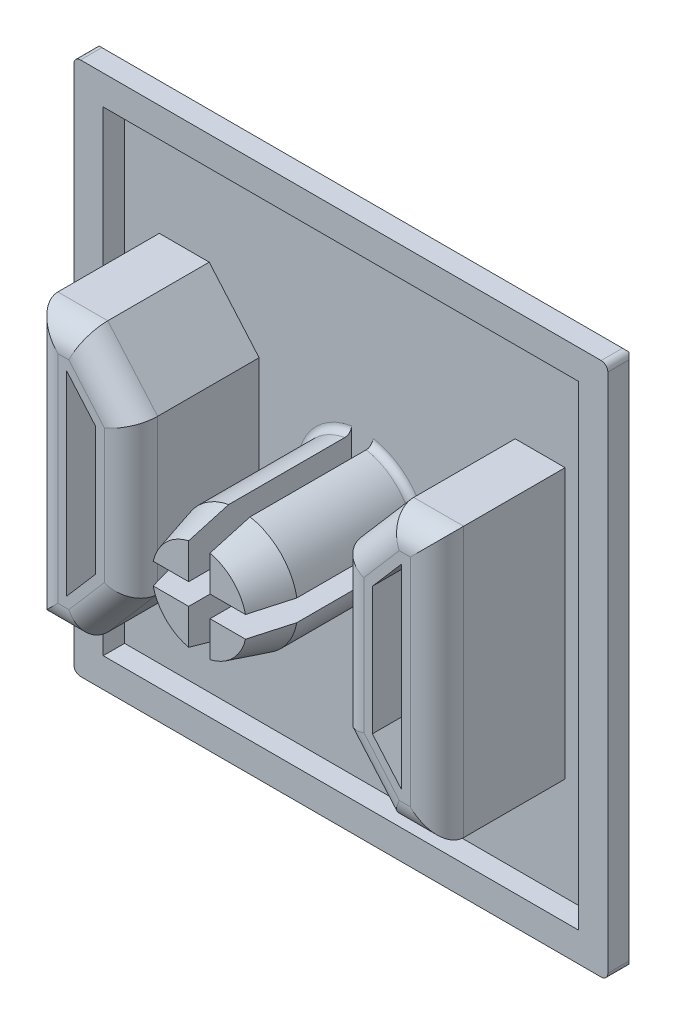
from build123d import *
from OCP.BRepFilletAPI import BRepFilletAPI_MakeChamfer

# Parameters (mm, degrees)
SKETCH3_W           = 20
SKETCH3_H           = 20
BOSS_EXTRUDE1_DEPTH = 2
SKETCH4_W           = 20
SKETCH4_H           = 20
SKETCH4_W_2         = 17.8
SKETCH4_H_2         = 17.8
BOSS_EXTRUDE2_DEPTH = 0.8
CHAMFER1_SIZE       = 2
BOSS_EXTRUDE3_DEPTH = 4.8
FILLET2_R           = 1
FILLET4_R           = 1
BOSS_EXTRUDE4_DEPTH = 6.1
CHAMFER2_SIZE       = 1.5
CHAMFER2_SIZE2      = 0.415986816
FILLET5_R           = 0.25
FILLET6_R           = 0.25


with BuildPart() as part:
    # Sketch3 → Boss-Extrude1 (new body)
    with BuildSketch(Plane.XY):
        Rectangle(SKETCH3_W, SKETCH3_H)
    extrude(amount=BOSS_EXTRUDE1_DEPTH)

    # Sketch4 → Boss-Extrude2 (add)
    with BuildSketch(Plane.XY.offset(2)):
        Rectangle(SKETCH4_W, SKETCH4_H)
        Rectangle(SKETCH4_W_2, SKETCH4_H_2, mode=Mode.SUBTRACT)
    extrude(amount=BOSS_EXTRUDE2_DEPTH)

    # Chamfer1
    chamfer1_edges = [part.edges().sort_by_distance(p)[0] for p in [
        (0, 10, 0),
        (10, 0, 0),
        (0, -10, 0),
        (-10, 0, 0),
    ]]
    chamfer(chamfer1_edges, length=CHAMFER1_SIZE)

    # Sketch7 → Boss-Extrude3 (add)
    with BuildSketch(Plane.XY.offset(2)):
        Polygon((-7.6, 5.05), (-7.6, -5.05), (-5.73, -5.05), (-3.861210285, -2.885), (-3.861210285, 2.885), (-5.73, 5.05), align=None)
        Polygon((-5.181210285, -2.394094045), (-5.181210285, 2.394094045), (-6.28, 3.667046113), (-6.28, -3.667046113), align=None, mode=Mode.SUBTRACT)
    boss_extrude3 = extrude(amount=BOSS_EXTRUDE3_DEPTH)

    # Mirror1: Boss-Extrude3 across plane
    add(boss_extrude3.mirror(Plane(origin=(0, 0, 0), x_dir=(0, 0, 1), z_dir=(1, 0, 0))))

    # Fillet2
    fillet2_edges = [part.edges().sort_by_distance(p)[0] for p in [
        (-6.665, 5.05, 6.8),
        (-7.6, 0, 6.8),
        (-6.665, -5.05, 6.8),
        (-4.795605142, -3.9675, 6.8),
        (-3.861210285, 0, 6.8),
        (-4.795605142, 3.9675, 6.8),
    ]]
    fillet(fillet2_edges, radius=FILLET2_R)

    # Fillet4
    fillet4_edges = [part.edges().sort_by_distance(p)[0] for p in [
        (6.665, 5.05, 6.8),
        (4.795605142, 3.9675, 6.8),
        (3.861210285, 0, 6.8),
        (4.795605142, -3.9675, 6.8),
        (6.665, -5.05, 6.8),
        (7.6, 0, 6.8),
    ]]
    fillet(fillet4_edges, radius=FILLET4_R)

    # Sketch8 → Boss-Extrude4 (add)
    with BuildSketch(Plane.XY.offset(2)):
        with BuildLine():
            Line((-0.4, 2.153160468), (-0.4, 0.4))
            Line((-0.4, 0.4), (-2.153160468, 0.4))
            ThreePointArc((-2.153160468, 0.4), (-1.548563851, 1.548563851), (-0.4, 2.153160468))
        make_face()
        with BuildLine():
            Line((0.4, 2.153160468), (0.4, 0.4))
            Line((0.4, 0.4), (2.153160468, 0.4))
            ThreePointArc((2.153160468, 0.4), (1.548563851, 1.548563851), (0.4, 2.153160468))
        make_face()
        with BuildLine():
            Line((2.153160468, -0.4), (0.4, -0.4))
            Line((0.4, -0.4), (0.4, -2.153160468))
            ThreePointArc((0.4, -2.153160468), (1.548563851, -1.548563851), (2.153160468, -0.4))
        make_face()
        with BuildLine():
            Line((-0.4, -0.4), (-2.153160468, -0.4))
            ThreePointArc((-2.153160468, -0.4), (-1.548563851, -1.548563851), (-0.4, -2.153160468))
            Line((-0.4, -2.153160468), (-0.4, -0.4))
        make_face()
    extrude(amount=BOSS_EXTRUDE4_DEPTH)

    # Chamfer2: one chamfer whose edges measure the first distance from different faces: ONE call of the kernel's chamfer builder (chamfer() names one face for all edges)
    chamfer2_edges_1 = [part.edges().sort_by_distance(p)[0] for p in [
        (1.548563851, 1.548563851, 8.1),
    ]]
    chamfer2_side_1 = [part.faces().sort_by_distance(p)[0] for p in [
        (1.548563851, 1.548563851, 5.05),
    ]]
    chamfer2_edges_2 = [part.edges().sort_by_distance(p)[0] for p in [
        (-1.548563851, 1.548563851, 8.1),
    ]]
    chamfer2_side_2 = [part.faces().sort_by_distance(p)[0] for p in [
        (-1.548563851, 1.548563851, 5.05),
    ]]
    chamfer2_edges_3 = [part.edges().sort_by_distance(p)[0] for p in [
        (1.548563851, -1.548563851, 8.1),
    ]]
    chamfer2_side_3 = [part.faces().sort_by_distance(p)[0] for p in [
        (1.548563851, -1.548563851, 5.05),
    ]]
    chamfer2_edges_4 = [part.edges().sort_by_distance(p)[0] for p in [
        (-1.548563851, -1.548563851, 8.1),
    ]]
    chamfer2_side_4 = [part.faces().sort_by_distance(p)[0] for p in [
        (-1.548563851, -1.548563851, 5.05),
    ]]
    chamfer2 = BRepFilletAPI_MakeChamfer(part.part.solid().wrapped)
    for e in chamfer2_edges_1:
        chamfer2.Add(CHAMFER2_SIZE, CHAMFER2_SIZE2, e.wrapped, chamfer2_side_1[0].wrapped)  # the first distance lies on this face
    for e in chamfer2_edges_2:
        chamfer2.Add(CHAMFER2_SIZE, CHAMFER2_SIZE2, e.wrapped, chamfer2_side_2[0].wrapped)  # the first distance lies on this face
    for e in chamfer2_edges_3:
        chamfer2.Add(CHAMFER2_SIZE, CHAMFER2_SIZE2, e.wrapped, chamfer2_side_3[0].wrapped)  # the first distance lies on this face
    for e in chamfer2_edges_4:
        chamfer2.Add(CHAMFER2_SIZE, CHAMFER2_SIZE2, e.wrapped, chamfer2_side_4[0].wrapped)  # the first distance lies on this face
    add(Compound.cast(chamfer2.Shape()), mode=Mode.REPLACE)

    # Fillet5
    # the kernel refuses this fillet: 0.25 mm, written as the material it adds along each edge
    with BuildSketch(Plane(origin=(0, 0, 2), x_dir=(0.9948253006506458, -0.10160030110857103, 0), z_dir=(-0.10160030110857103, -0.9948253006506458, 0))) as fillet5_piece_1_section:
        with BuildLine():
            CenterArc((2.19 + FILLET5_R, FILLET5_R), FILLET5_R, 180, 90)
            Line((2.19, FILLET5_R), (2.19, 0))
            Line((2.19, 0), (2.19 + FILLET5_R, 0))
        make_face()
    fillet5_piece_1 = revolve(axis=Axis((0, 0, 2), (0, 0, 1)), revolution_arc=101.662660771, mode=Mode.PRIVATE)
    fillet5_piece_1 = split(fillet5_piece_1, bisect_by=Plane(origin=(0.4, 1.598681541, 2.070877118), z_dir=(1, 0, 0)), keep=Keep.TOP, mode=Mode.PRIVATE)
    fillet5_piece_1 = split(fillet5_piece_1, bisect_by=Plane(origin=(1.598681541, 0.4, 2.070877118), z_dir=(0, 1, 0)), keep=Keep.TOP, mode=Mode.PRIVATE)
    add(fillet5_piece_1)
    with BuildSketch(Plane(origin=(0, 0, 2), x_dir=(-0.9948253006506458, -0.10160030110857048, 0), z_dir=(0.10160030110857048, -0.9948253006506458, 0))) as fillet5_piece_2_section:
        with BuildLine():
            CenterArc((2.19 + FILLET5_R, -FILLET5_R), FILLET5_R, 90, 90)
            Line((2.19, -FILLET5_R), (2.19, 0))
            Line((2.19, 0), (2.19 + FILLET5_R, 0))
        make_face()
    fillet5_piece_2 = revolve(axis=Axis((0, 0, 2), (0, 0, -1)), revolution_arc=101.662660771, mode=Mode.PRIVATE)
    fillet5_piece_2 = split(fillet5_piece_2, bisect_by=Plane(origin=(-1.598681541, 0.4, 2.070877118), z_dir=(0, 1, 0)), keep=Keep.TOP, mode=Mode.PRIVATE)
    fillet5_piece_2 = split(fillet5_piece_2, bisect_by=Plane(origin=(-0.4, 1.598681541, 2.070877118), z_dir=(-1, 0, 0)), keep=Keep.TOP, mode=Mode.PRIVATE)
    add(fillet5_piece_2)
    with BuildSketch(Plane(origin=(0, 0, 2), x_dir=(-0.1016003011085696, -0.9948253006506458, 0), z_dir=(-0.9948253006506458, 0.1016003011085696, 0))) as fillet5_piece_3_section:
        with BuildLine():
            CenterArc((2.19 + FILLET5_R, FILLET5_R), FILLET5_R, 180, 90)
            Line((2.19, FILLET5_R), (2.19, 0))
            Line((2.19, 0), (2.19 + FILLET5_R, 0))
        make_face()
    fillet5_piece_3 = revolve(axis=Axis((0, 0, 2), (0, 0, 1)), revolution_arc=101.662660771, mode=Mode.PRIVATE)
    fillet5_piece_3 = split(fillet5_piece_3, bisect_by=Plane(origin=(1.598681541, -0.4, 2.070877118), z_dir=(0, -1, 0)), keep=Keep.TOP, mode=Mode.PRIVATE)
    fillet5_piece_3 = split(fillet5_piece_3, bisect_by=Plane(origin=(0.4, -1.598681541, 2.070877118), z_dir=(1, 0, 0)), keep=Keep.TOP, mode=Mode.PRIVATE)
    add(fillet5_piece_3)
    with BuildSketch(Plane(origin=(0, 0, 2), x_dir=(-0.994825300650646, 0.10160030110856982, 0), z_dir=(0.10160030110856982, 0.994825300650646, 0))) as fillet5_piece_4_section:
        with BuildLine():
            CenterArc((2.19 + FILLET5_R, FILLET5_R), FILLET5_R, 180, 90)
            Line((2.19 + FILLET5_R, 0), (2.19, 0))
            Line((2.19, 0), (2.19, FILLET5_R))
        make_face()
    fillet5_piece_4 = revolve(axis=Axis((0, 0, 2), (0, 0, 1)), revolution_arc=101.662660771, mode=Mode.PRIVATE)
    fillet5_piece_4 = split(fillet5_piece_4, bisect_by=Plane(origin=(-0.4, -1.598681541, 2.070877118), z_dir=(-1, 0, 0)), keep=Keep.TOP, mode=Mode.PRIVATE)
    fillet5_piece_4 = split(fillet5_piece_4, bisect_by=Plane(origin=(-1.598681541, -0.4, 2.070877118), z_dir=(0, -1, 0)), keep=Keep.TOP, mode=Mode.PRIVATE)
    add(fillet5_piece_4)

    # Fillet6
    fillet6_edges = [part.edges().sort_by_distance(p)[0] for p in [
        (8, 0, 0),
        (0, 8, 0),
        (0, -8, 0),
        (-8, 0, 0),
        (-10, 10, 2.4),
        (10, 10, 2.4),
        (10, -10, 2.4),
        (-10, -10, 2.4),
    ]]
    fillet(fillet6_edges, radius=FILLET6_R)


solid = part.part
